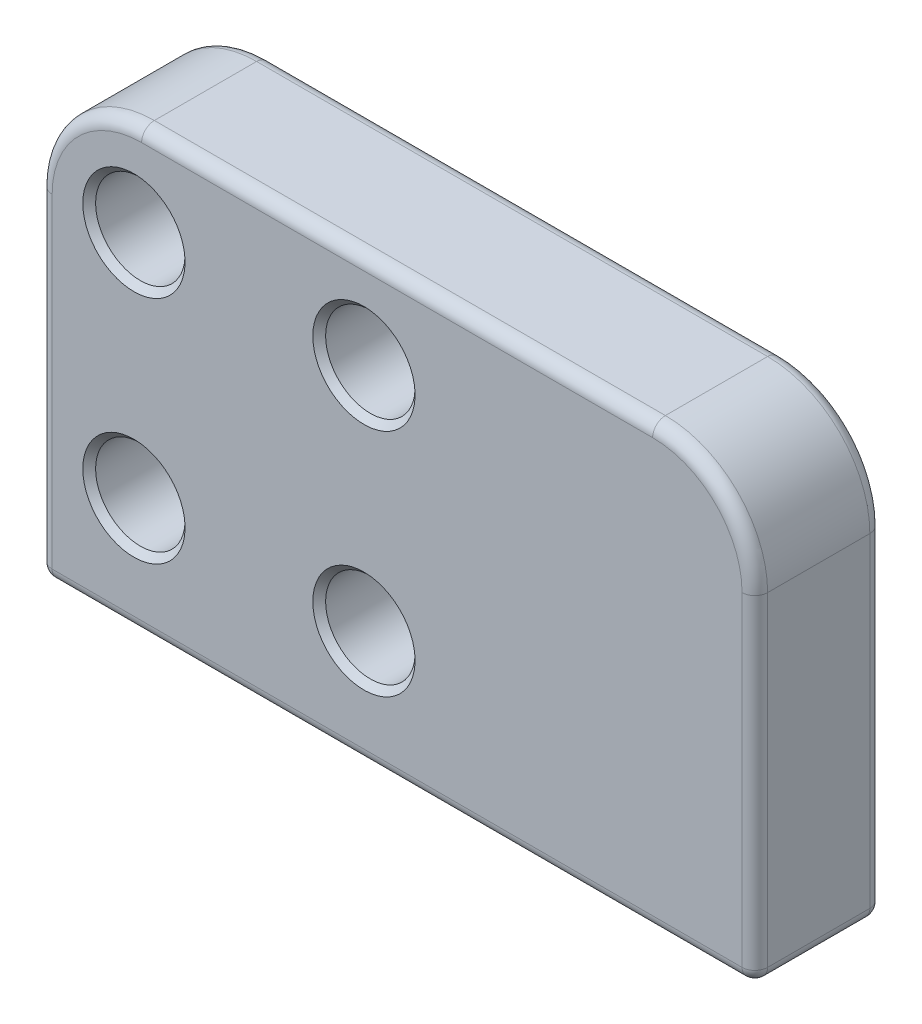
from build123d import *

# Parameters (mm, degrees)
SKETCH1_W           = 55.99
SKETCH1_H           = 87.9
SKETCH1_R           = 3.5
BOSS_EXTRUDE1_DEPTH = 10
FILLET1_R           = 8
FILLET2_R           = 1
CHAMFER1_SIZE       = 0.5


# Read off the part's stored shape, not the designer's step: Split1
with BuildPart() as part:
    # Sketch1 → Boss-Extrude1 (new body)
    with BuildSketch(Plane.XY):
        with Locations((-17.995, 31.45)):
            Rectangle(SKETCH1_W, SKETCH1_H)
        Circle(SKETCH1_R, mode=Mode.SUBTRACT)
        with Locations((-6.59, 32)):
            Circle(SKETCH1_R, mode=Mode.SUBTRACT)
        with Locations((-20.59, 32)):
            Circle(SKETCH1_R, mode=Mode.SUBTRACT)
        with Locations((-14, 0)):
            Circle(SKETCH1_R, mode=Mode.SUBTRACT)
        with Locations((-20.59, 50)):
            Circle(SKETCH1_R, mode=Mode.SUBTRACT)
        with Locations((-20.59, 68)):
            Circle(SKETCH1_R, mode=Mode.SUBTRACT)
        with Locations((-38.59, 68)):
            Circle(SKETCH1_R, mode=Mode.SUBTRACT)
        with Locations((-38.59, 50)):
            Circle(SKETCH1_R, mode=Mode.SUBTRACT)
    extrude(amount=BOSS_EXTRUDE1_DEPTH)

    # Fillet1
    fillet1_edges = [part.edges().sort_by_distance(p)[0] for p in [
        (-45.99, -12.5, 5),
        (-45.99, 75.4, 5),
        (10, 75.4, 5),
        (10, -12.5, 5),
    ]]
    fillet(fillet1_edges, radius=FILLET1_R)


with BuildPart() as body_2:
    # Split1: the piece on the far side of the plane
    add(part.part)
    split(bisect_by=Plane(origin=(0, 41, 0), x_dir=(1, 0, 0), z_dir=(0, 1, 0)), keep=Keep.BOTTOM)


with BuildPart() as part_1:
    add(part.part)

    # Split1
    split(bisect_by=Plane(origin=(0, 41, 0), x_dir=(1, 0, 0), z_dir=(0, 1, 0)), keep=Keep.TOP)

    # Fillet2
    fillet2_edges = [part_1.edges().sort_by_distance(p)[0] for p in [
        (-17.995, 41, 0),
        (-45.99, 54.2, 0),
        (-17.995, 75.4, 0),
        (7.656854249, 73.056854249, 0),
        (-43.646854249, 73.056854249, 0),
        (-17.995, 75.4, 10),
        (-45.99, 54.2, 10),
        (7.656854249, 73.056854249, 10),
        (-43.646854249, 73.056854249, 10),
        (-45.99, 41, 5),
        (10, 54.2, 10),
        (10, 54.2, 0),
        (10, 41, 5),
        (-17.995, 41, 10),
    ]]
    fillet(fillet2_edges, radius=FILLET2_R)

    # Chamfer1
    chamfer1_edges = [part_1.edges().sort_by_distance(p)[0] for p in [
        (-24.09, 50, 0),
        (-24.09, 50, 10),
        (-24.09, 68, 0),
        (-24.09, 68, 10),
        (-42.09, 68, 0),
        (-42.09, 68, 10),
        (-42.09, 50, 0),
        (-42.09, 50, 10),
    ]]
    chamfer(chamfer1_edges, length=CHAMFER1_SIZE)


solid = part_1.part
